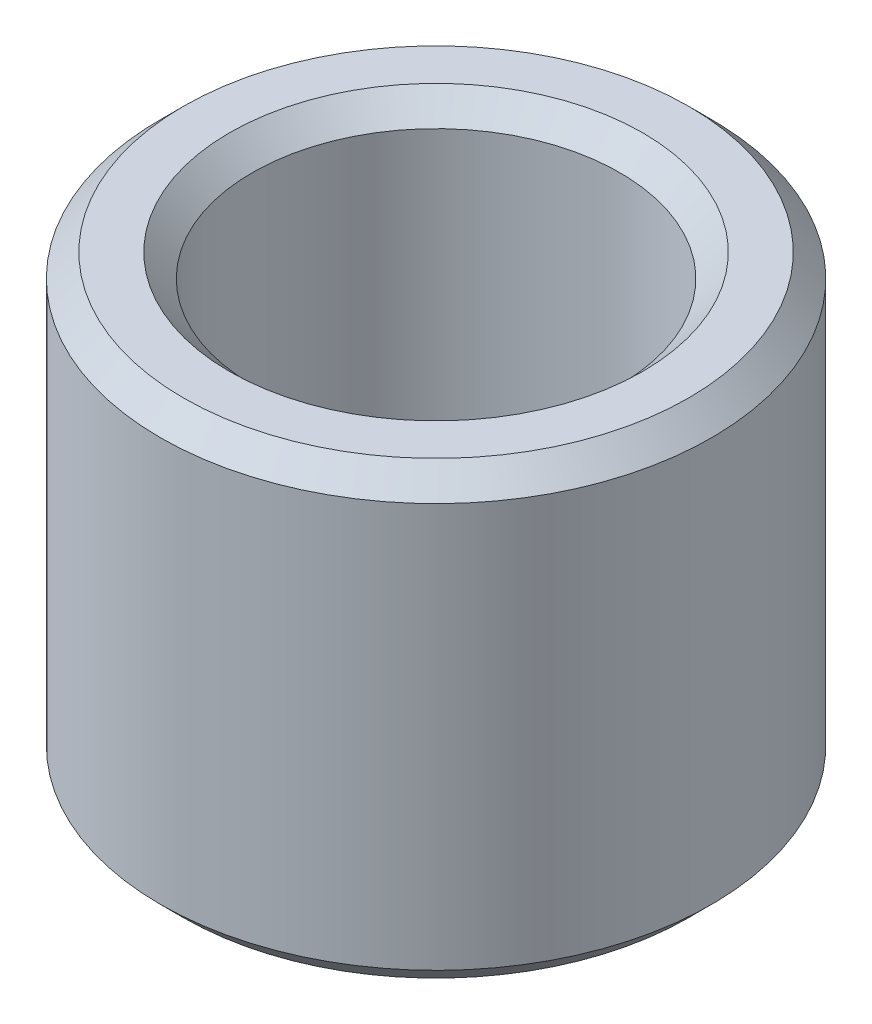
from build123d import *

# Parameters (mm, degrees)
SKETCH_1_R      = 3
SKETCH_1_R_2    = 2
EXTRUDE_1_DEPTH = 2.45
CHAMFER_1_SIZE  = 0.25


with BuildPart() as part:
    # ｽｹｯﾁ1 → ﾎﾞｽ - 押し出し1 (new, symmetric)
    with BuildSketch(Plane(origin=(0, 0, 0), x_dir=(1, 0, 0), z_dir=(0, 1, 0))):
        Circle(SKETCH_1_R)
        Circle(SKETCH_1_R_2, mode=Mode.SUBTRACT)
    extrude(amount=EXTRUDE_1_DEPTH, both=True)

    # 面取り1
    chamfer_1_edges = [part.edges().sort_by_distance(p)[0] for p in [
        (-3, -2.45, 0),
        (-3, 2.45, 0),
        (-2, -2.45, 0),
        (-2, 2.45, 0),
    ]]
    chamfer(chamfer_1_edges, length=CHAMFER_1_SIZE)


solid = part.part
